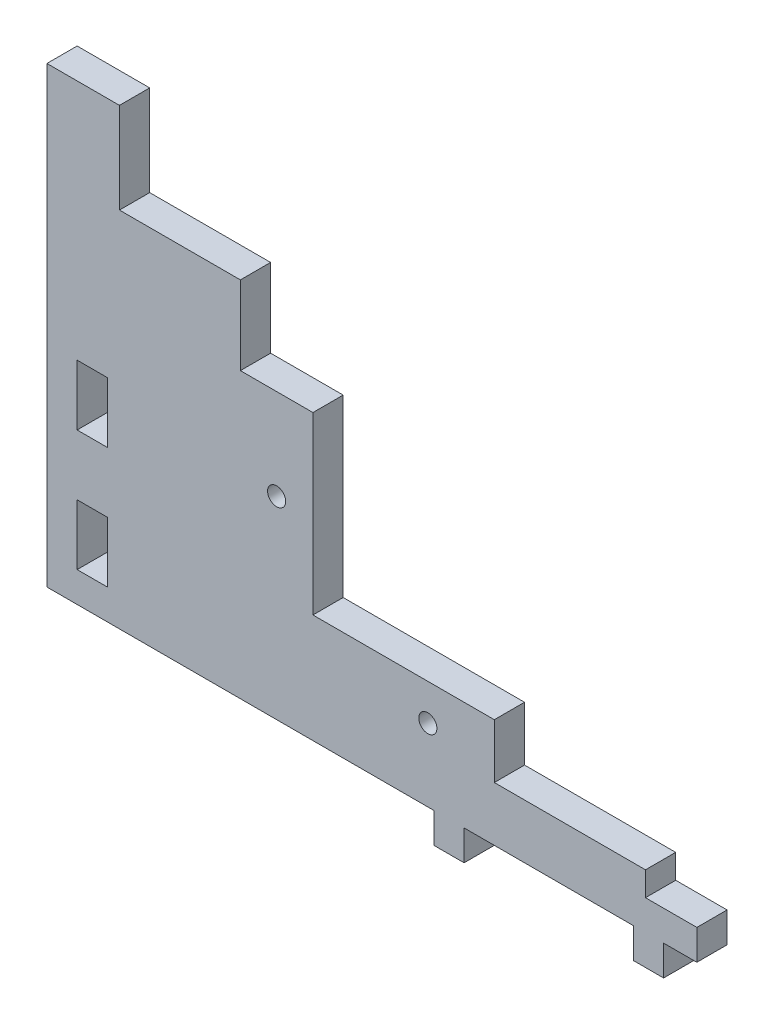
from build123d import *

# Parameters (mm, degrees)
ESQUISSE1_R        = 1.5
BOSS_EXTRU_1_DEPTH = 5
ESQUISSE2_W        = 5
ESQUISSE2_H        = 10
BOSS_EXTRU_2_DEPTH = 5


with BuildPart() as part:
    # Esquisse1 → Boss.-Extru.1 (new body)
    with BuildSketch(Plane.XY):
        Polygon((0, 0), (32, 0), (32, -5), (37, -5), (37, 0), (37, 18), (12, 18), (12, 47), (0, 47), align=None)
        with Locations((6, 32)):
            Circle(ESQUISSE1_R, mode=Mode.SUBTRACT)
        with Locations((31, 12)):
            Circle(ESQUISSE1_R, mode=Mode.SUBTRACT)
    extrude(amount=BOSS_EXTRU_1_DEPTH)

    # Esquisse2 → Boss.-Extru.2 (add)
    # profile 1 of 2: a face of its own
    with BuildSketch(Plane(origin=(0, 0, 0), x_dir=(-1, 0, 0), z_dir=(0, 0, -1))):
        Polygon((-65, 0), (-37, 0), (-37, 18), (-42, 18), (-42, 9), (-67, 9), (-67, 5), (-75.5, 5), (-75.5, 0), (-70, 0), (-70, -5), (-65, -5), align=None)
    # profile 2 of 2: a face of its own
    with BuildSketch(Plane(origin=(0, 0, 0), x_dir=(-1, 0, 0), z_dir=(0, 0, -1))):
        Polygon((0, 60), (0, 0), (32, 0), (32, 75), (20, 75), (20, 60), align=None)
        with Locations((24.5, 10)):
            Rectangle(ESQUISSE2_W, ESQUISSE2_H, mode=Mode.SUBTRACT)
        with Locations((24.5, 30)):
            Rectangle(ESQUISSE2_W, ESQUISSE2_H, mode=Mode.SUBTRACT)
    extrude(amount=-BOSS_EXTRU_2_DEPTH)


solid = part.part
